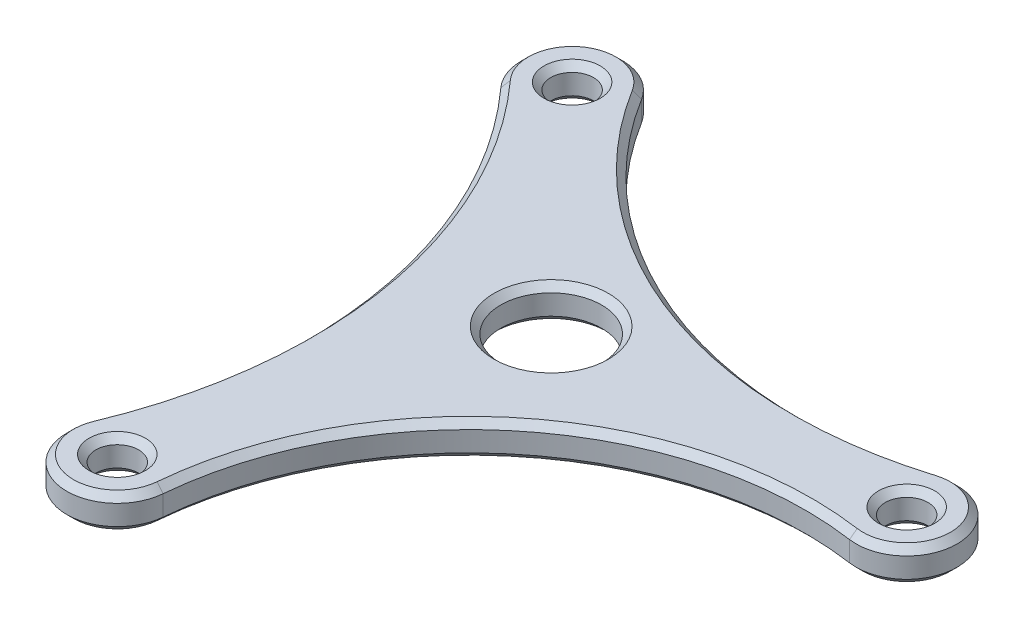
from build123d import *

# Parameters (mm, degrees)
STOCK_TEATHERED_START                        = 85.075
STOCK_TEATHERED_SWERVE_OUTER_MODUAL_1_OU_R   = 2.0193
STOCK_TEATHERED_SWERVE_OUTER_MODUAL_1_OU_R_2 = 4.7625
STOCK_TEATHERED_SWERVE_OUTER_MODUAL_1_DEPTH  = 3.175
CHAMFER1_SIZE                                = 0.635


# Read off the part's stored shape, not the designer's step: Stock-Teathered Swerve Outer Modual-1
with BuildPart() as part:
    # Stock-Teathered Swerve Outer Modual-1 ou → Stock-Teathered Swerve Outer Modual-1 (new body)
    with BuildSketch(Plane(origin=(0, 0, 0), x_dir=(1, 0, 0), z_dir=(0, 1, 0)).offset(STOCK_TEATHERED_START)):
        with BuildLine():
            ThreePointArc((69.17405827, 6.398212246), (74.59793655, 11.484662283), (68.44777711, 15.663892887))
            ThreePointArc((68.44777711, 15.663892887), (43.031292772, 16.425853008), (23.381787081, 32.565096654))
            ThreePointArc((23.381787081, 32.565096654), (16.469460575, 33.864059213), (15.801303162, 26.862550296))
            ThreePointArc((15.801303162, 26.862550296), (26.644984318, 4.602603852), (23.897134883, -20.005117705))
            ThreePointArc((23.897134883, -20.005117705), (27.16089255, -26.456318028), (33.039902775, -22.248309176))
            ThreePointArc((33.039902775, -22.248309176), (44.943402215, -0.150432703), (69.17405827, 6.398212246))
        make_face()
        with Locations((28.295721181, -21.830999635)):
            Circle(STOCK_TEATHERED_SWERVE_OUTER_MODUAL_1_OU_R, mode=Mode.SUBTRACT)
        with Locations((38.300729341, 9.113233891)):
            Circle(STOCK_TEATHERED_SWERVE_OUTER_MODUAL_1_OU_R_2, mode=Mode.SUBTRACT)
        with Locations((19.332478919, 30.058204223)):
            Circle(STOCK_TEATHERED_SWERVE_OUTER_MODUAL_1_OU_R, mode=Mode.SUBTRACT)
        with Locations((69.85, 11.1125)):
            Circle(STOCK_TEATHERED_SWERVE_OUTER_MODUAL_1_OU_R, mode=Mode.SUBTRACT)
    extrude(amount=STOCK_TEATHERED_SWERVE_OUTER_MODUAL_1_DEPTH)

    # Chamfer1
    chamfer1_edges = [part.edges().sort_by_distance(p)[0] for p in [
        (26.644984318, 88.25, -4.602603852),
        (27.16089255, 88.25, 26.456318028),
        (33.538229341, 85.075, -9.113233891),
        (33.538229341, 88.25, -9.113233891),
        (26.276421181, 85.075, 21.830999635),
        (44.943402215, 88.25, 0.150432703),
        (26.276421181, 88.25, 21.830999635),
        (67.8307, 85.075, -11.1125),
        (74.59793655, 88.25, -11.484662283),
        (67.8307, 88.25, -11.1125),
        (17.313178919, 85.075, -30.058204223),
        (17.313178919, 88.25, -30.058204223),
        (43.031292772, 88.25, -16.425853008),
        (74.59793655, 85.075, -11.484662283),
        (44.943402215, 85.075, 0.150432703),
        (27.16089255, 85.075, 26.456318028),
        (26.644984318, 85.075, -4.602603852),
        (16.469460575, 85.075, -33.864059213),
        (43.031292772, 85.075, -16.425853008),
        (16.469460575, 88.25, -33.864059213),
    ]]
    chamfer(chamfer1_edges, length=CHAMFER1_SIZE)


solid = part.part
